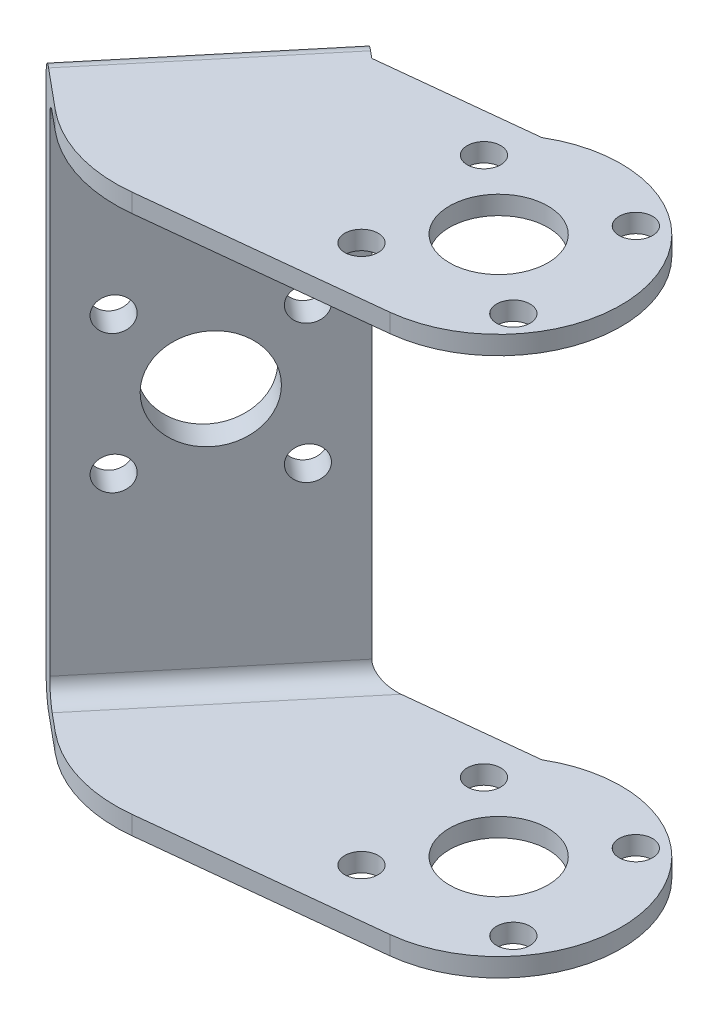
from build123d import *

# Parameters (mm, degrees)
CROQUIS1_R              = 5.3
SALIENTE_EXTRUIR1_DEPTH = 2
CROQUIS2_R              = 1.8
CORTAR_EXTRUIR1_DEPTH   = 2
CROQUIS3_W              = 24.61
CROQUIS3_H              = 60
SALIENTE_EXTRUIR2_DEPTH = 2
CROQUIS4_R              = 5.3
CROQUIS4_R_2            = 1.8
SALIENTE_EXTRUIR3_DEPTH = 2
CORTAR_EXTRUIR2_REACH   = 77.899
CROQUIS5_R              = 5.4
CROQUIS5_R_2            = 1.8
CROQUIS6_W              = 24.61
CROQUIS6_H              = 60
SALIENTE_EXTRUIR4_DEPTH = 1
CORTAR_EXTRUIR3_REACH   = 78.513
CROQUIS7_R              = 5.4
CROQUIS7_R_2            = 1.8
REDONDEO1_R             = 2


with BuildPart() as part:
    # Croquis1 → Saliente-Extruir1 (new body)
    with BuildSketch(Plane(origin=(0, 0, 0), x_dir=(1, 0, 0), z_dir=(0, 1, 0))):
        with BuildLine():
            Line((-10.994972408, -15.789813385), (14.087680331, -13.105147381))
            ThreePointArc((14.087680331, -13.105147381), (25.196689721, 4.143672323), (5.987949996, 11.351736486))
            Line((5.987949996, 11.351736486), (-10.55372573, 9.581234979))
            Line((-10.55372573, 9.581234979), (-26.287258722, -9.342507769))
            Line((-26.287258722, -9.342507769), (-22.837316291, -12.210850664))
            ThreePointArc((-22.837316291, -12.210850664), (-17.278998917, -15.200972796), (-10.994972408, -15.789813385))
        make_face()
        with Locations((12.685, 0)):
            Circle(CROQUIS1_R, mode=Mode.SUBTRACT)
    extrude(amount=SALIENTE_EXTRUIR1_DEPTH)

    # Croquis2 → Cortar-Extruir1 (cut)
    with BuildSketch(Plane(origin=(0, 2, 0), x_dir=(1, 0, 0), z_dir=(0, 1, 0))):
        with Locations((6.092709789, -8.172619517)):
            Circle(CROQUIS2_R)
        with Locations((20.857619517, -6.592290211)):
            Circle(CROQUIS2_R)
        with Locations((19.277290211, 8.172619517)):
            Circle(CROQUIS2_R)
        with Locations((4.512380483, 6.592290211)):
            Circle(CROQUIS2_R)
    extrude(amount=-CORTAR_EXTRUIR1_DEPTH, mode=Mode.SUBTRACT)

    # Croquis3 → Saliente-Extruir2 (add)
    with BuildSketch(Plane(origin=(-10.950288723, 0, -9.104262893), x_dir=(-0.6393146278783002, 0, 0.7689452559063166), z_dir=(-0.7689452559063167, 0, -0.6393146278783002))):
        with Locations((11.684706055, 30)):
            Rectangle(CROQUIS3_W, CROQUIS3_H)
    extrude(amount=SALIENTE_EXTRUIR2_DEPTH)

    # Croquis4 → Saliente-Extruir3 (add)
    with BuildSketch(Plane(origin=(0, 60, 0), x_dir=(1, 0, 0), z_dir=(0, 1, 0))):
        with BuildLine():
            Line((14.087680331, -13.105147381), (-10.994972408, -15.789813385))
            ThreePointArc((-10.994972408, -15.789813385), (-17.278998917, -15.200972796), (-22.837316291, -12.210850664))
            Line((-22.837316291, -12.210850664), (-26.287258722, -9.342507769))
            Line((-26.287258722, -9.342507769), (-10.55372573, 9.581234979))
            Line((-10.55372573, 9.581234979), (5.987949996, 11.351736486))
            ThreePointArc((5.987949996, 11.351736486), (25.196689721, 4.143672323), (14.087680331, -13.105147381))
        make_face()
        with Locations((12.685, 0)):
            Circle(CROQUIS4_R, mode=Mode.SUBTRACT)
        with Locations((4.512380483, 6.592290211)):
            Circle(CROQUIS4_R_2, mode=Mode.SUBTRACT)
        with Locations((19.277290211, 8.172619517)):
            Circle(CROQUIS4_R_2, mode=Mode.SUBTRACT)
        with Locations((20.857619517, -6.592290211)):
            Circle(CROQUIS4_R_2, mode=Mode.SUBTRACT)
        with Locations((6.092709789, -8.172619517)):
            Circle(CROQUIS4_R_2, mode=Mode.SUBTRACT)
    extrude(amount=-SALIENTE_EXTRUIR3_DEPTH)

    # Croquis5 → Cortar-Extruir2 (cut, up to next)
    with BuildSketch(Plane(origin=(-12.488179234, 0, -10.382892148), x_dir=(-0.6393146278783002, 0, 0.7689452559063166), z_dir=(-0.7689452559063167, 0, -0.6393146278783002)), mode=Mode.PRIVATE) as cortar_extruir2_sk1:
        with Locations((11.684706055, 30)):
            Circle(CROQUIS5_R)
    cortar_extruir2_tool1 = extrude(cortar_extruir2_sk1.sketch, amount=-CORTAR_EXTRUIR2_REACH, mode=Mode.PRIVATE) & part.part
    # Croquis5 → Cortar-Extruir2 (cut, up to next)
    with BuildSketch(Plane(origin=(-12.488179234, 0, -10.382892148), x_dir=(-0.6393146278783002, 0, 0.7689452559063166), z_dir=(-0.7689452559063167, 0, -0.6393146278783002)), mode=Mode.PRIVATE) as cortar_extruir2_sk2:
        with Locations((19.109327257, 37.424621202)):
            Circle(CROQUIS5_R_2)
    cortar_extruir2_tool2 = extrude(cortar_extruir2_sk2.sketch, amount=-CORTAR_EXTRUIR2_REACH, mode=Mode.PRIVATE) & part.part
    # Croquis5 → Cortar-Extruir2 (cut, up to next)
    with BuildSketch(Plane(origin=(-12.488179234, 0, -10.382892148), x_dir=(-0.6393146278783002, 0, 0.7689452559063166), z_dir=(-0.7689452559063167, 0, -0.6393146278783002)), mode=Mode.PRIVATE) as cortar_extruir2_sk3:
        with Locations((19.109327257, 22.575378798)):
            Circle(CROQUIS5_R_2)
    cortar_extruir2_tool3 = extrude(cortar_extruir2_sk3.sketch, amount=-CORTAR_EXTRUIR2_REACH, mode=Mode.PRIVATE) & part.part
    # Croquis5 → Cortar-Extruir2 (cut, up to next)
    with BuildSketch(Plane(origin=(-12.488179234, 0, -10.382892148), x_dir=(-0.6393146278783002, 0, 0.7689452559063166), z_dir=(-0.7689452559063167, 0, -0.6393146278783002)), mode=Mode.PRIVATE) as cortar_extruir2_sk4:
        with Locations((4.260084852, 22.575378798)):
            Circle(CROQUIS5_R_2)
    cortar_extruir2_tool4 = extrude(cortar_extruir2_sk4.sketch, amount=-CORTAR_EXTRUIR2_REACH, mode=Mode.PRIVATE) & part.part
    # Croquis5 → Cortar-Extruir2 (cut, up to next)
    with BuildSketch(Plane(origin=(-12.488179234, 0, -10.382892148), x_dir=(-0.6393146278783002, 0, 0.7689452559063166), z_dir=(-0.7689452559063167, 0, -0.6393146278783002)), mode=Mode.PRIVATE) as cortar_extruir2_sk5:
        with Locations((4.260084852, 37.424621202)):
            Circle(CROQUIS5_R_2)
    cortar_extruir2_tool5 = extrude(cortar_extruir2_sk5.sketch, amount=-CORTAR_EXTRUIR2_REACH, mode=Mode.PRIVATE) & part.part
    add(cortar_extruir2_tool1.solids().sort_by_distance((-19.958383, 30, -1.397993))[0], mode=Mode.SUBTRACT)
    add(cortar_extruir2_tool2.solids().sort_by_distance((-24.705052, 37.424621, 4.311134))[0], mode=Mode.SUBTRACT)
    add(cortar_extruir2_tool3.solids().sort_by_distance((-24.705052, 22.575379, 4.311134))[0], mode=Mode.SUBTRACT)
    add(cortar_extruir2_tool4.solids().sort_by_distance((-15.211714, 22.575379, -7.10712))[0], mode=Mode.SUBTRACT)
    add(cortar_extruir2_tool5.solids().sort_by_distance((-15.211714, 37.424621, -7.10712))[0], mode=Mode.SUBTRACT)

    # Croquis6 → Saliente-Extruir4 (add)
    with BuildSketch(Plane(origin=(-12.488179234, 0, -10.382892148), x_dir=(0.6393146278783002, 0, -0.7689452559063166), z_dir=(0.7689452559063167, 0, 0.6393146278783002))):
        with Locations((-11.684706055, 30)):
            Rectangle(CROQUIS6_W, CROQUIS6_H)
    extrude(amount=-SALIENTE_EXTRUIR4_DEPTH)

    # Croquis7 → Cortar-Extruir3 (cut, up to next)
    with BuildSketch(Plane(origin=(-13.25712449, 0, -11.022206776), x_dir=(-0.6393146278783003, 0, 0.7689452559063165), z_dir=(-0.7689452559063165, 0, -0.6393146278783003)), mode=Mode.PRIVATE) as cortar_extruir3_sk1:
        with Locations((11.684706055, 30)):
            Circle(CROQUIS7_R)
    cortar_extruir3_tool1 = extrude(cortar_extruir3_sk1.sketch, amount=-CORTAR_EXTRUIR3_REACH, mode=Mode.PRIVATE) & part.part
    # Croquis7 → Cortar-Extruir3 (cut, up to next)
    with BuildSketch(Plane(origin=(-13.25712449, 0, -11.022206776), x_dir=(-0.6393146278783003, 0, 0.7689452559063165), z_dir=(-0.7689452559063165, 0, -0.6393146278783003)), mode=Mode.PRIVATE) as cortar_extruir3_sk2:
        with Locations((4.260084852, 37.424621202)):
            Circle(CROQUIS7_R_2)
    cortar_extruir3_tool2 = extrude(cortar_extruir3_sk2.sketch, amount=-CORTAR_EXTRUIR3_REACH, mode=Mode.PRIVATE) & part.part
    # Croquis7 → Cortar-Extruir3 (cut, up to next)
    with BuildSketch(Plane(origin=(-13.25712449, 0, -11.022206776), x_dir=(-0.6393146278783003, 0, 0.7689452559063165), z_dir=(-0.7689452559063165, 0, -0.6393146278783003)), mode=Mode.PRIVATE) as cortar_extruir3_sk3:
        with Locations((19.109327257, 37.424621202)):
            Circle(CROQUIS7_R_2)
    cortar_extruir3_tool3 = extrude(cortar_extruir3_sk3.sketch, amount=-CORTAR_EXTRUIR3_REACH, mode=Mode.PRIVATE) & part.part
    # Croquis7 → Cortar-Extruir3 (cut, up to next)
    with BuildSketch(Plane(origin=(-13.25712449, 0, -11.022206776), x_dir=(-0.6393146278783003, 0, 0.7689452559063165), z_dir=(-0.7689452559063165, 0, -0.6393146278783003)), mode=Mode.PRIVATE) as cortar_extruir3_sk4:
        with Locations((19.109327257, 22.575378798)):
            Circle(CROQUIS7_R_2)
    cortar_extruir3_tool4 = extrude(cortar_extruir3_sk4.sketch, amount=-CORTAR_EXTRUIR3_REACH, mode=Mode.PRIVATE) & part.part
    # Croquis7 → Cortar-Extruir3 (cut, up to next)
    with BuildSketch(Plane(origin=(-13.25712449, 0, -11.022206776), x_dir=(-0.6393146278783003, 0, 0.7689452559063165), z_dir=(-0.7689452559063165, 0, -0.6393146278783003)), mode=Mode.PRIVATE) as cortar_extruir3_sk5:
        with Locations((4.260084852, 22.575378798)):
            Circle(CROQUIS7_R_2)
    cortar_extruir3_tool5 = extrude(cortar_extruir3_sk5.sketch, amount=-CORTAR_EXTRUIR3_REACH, mode=Mode.PRIVATE) & part.part
    add(cortar_extruir3_tool1.solids().sort_by_distance((-20.727328, 30, -2.037307))[0], mode=Mode.SUBTRACT)
    add(cortar_extruir3_tool2.solids().sort_by_distance((-15.980659, 37.424621, -7.746435))[0], mode=Mode.SUBTRACT)
    add(cortar_extruir3_tool3.solids().sort_by_distance((-25.473997, 37.424621, 3.67182))[0], mode=Mode.SUBTRACT)
    add(cortar_extruir3_tool4.solids().sort_by_distance((-25.473997, 22.575379, 3.67182))[0], mode=Mode.SUBTRACT)
    add(cortar_extruir3_tool5.solids().sort_by_distance((-15.980659, 22.575379, -7.746435))[0], mode=Mode.SUBTRACT)

    # Redondeo1
    redondeo1_edges = [part.edges().sort_by_distance(p)[0] for p in [
        (-20.727327994, 0, -2.037307489),
        (-20.727327994, 60, -2.037307489),
        (-18.420492226, 58, -0.119363605),
        (-18.420492226, 2, -0.119363605),
    ]]
    fillet(redondeo1_edges, radius=REDONDEO1_R)


solid = part.part
